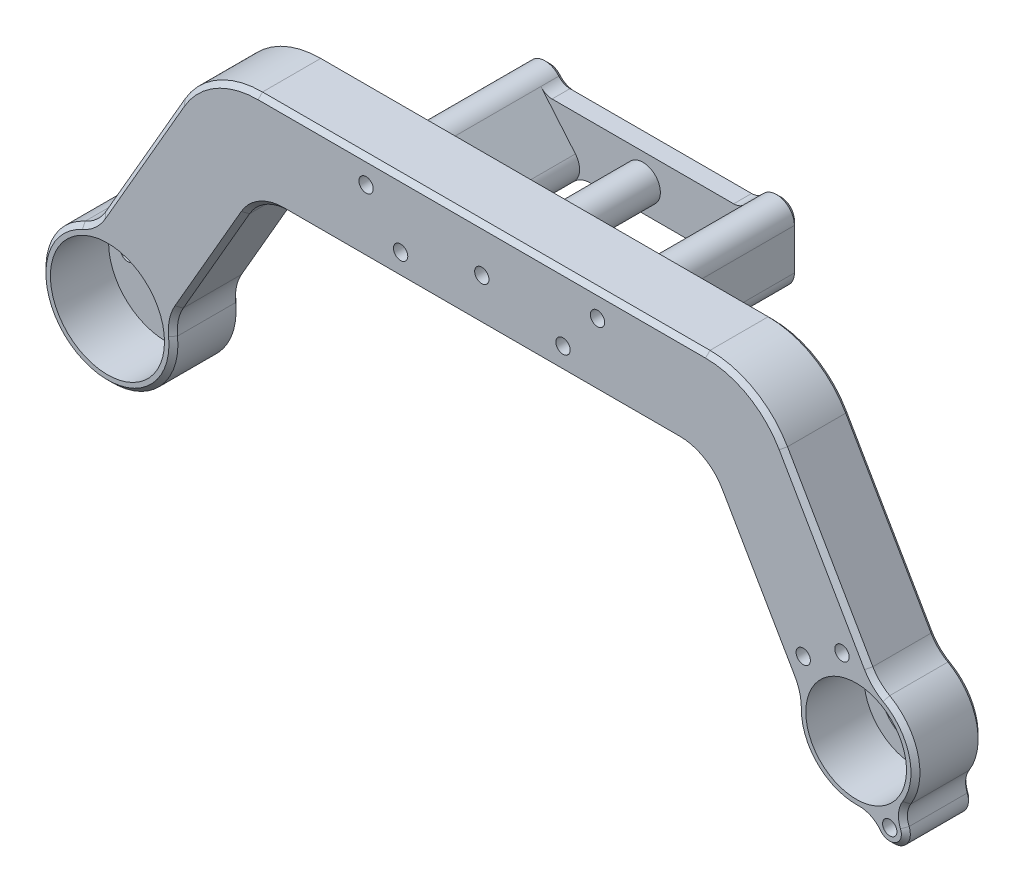
from build123d import *

# Parameters (mm, degrees)
BOSS_EXTRUDE1_DEPTH             = 7.5
CUT_EXTRUDE1_DEPTH              = 111.578168244
CUT_EXTRUDE1_DEPTH_BACK         = 111.578168244
SKETCH3_R                       = 1.6
SKETCH4_R                       = 1.6
BOSS_EXTRUDE2_DEPTH             = 21
BOSS_EXTRUDE2_2_DEPTH           = 21
SKETCH4_R_2                     = 3.9
BOSS_EXTRUDE2_3_DEPTH           = 21
BOSS_EXTRUDE3_START             = 5
SKETCH4_3_R                     = 1.6
SKETCH4_3_R_2                   = 3.9
BOSS_EXTRUDE3_DEPTH             = 5
CHAMFER1_SIZE                   = 1
BOSS_EXTRUDE4_REACH             = 117.298
SKETCH5_R                       = 13.25
SKETCH5_R_2                     = 11.25
BOSS_EXTRUDE4_DIRECTION_2_REACH = 117.298
CUT_EXTRUDE2_DEPTH              = 120.592667834
CUT_EXTRUDE2_DEPTH_BACK         = 120.592667834
SKETCH5_3_R                     = 11.25
BOSS_EXTRUDE5_START             = 5.5
SKETCH5_4_R                     = 11.25
SKETCH5_4_R_2                   = 7.5
BOSS_EXTRUDE5_DEPTH             = 2
CUT_EXTRUDE3_DEPTH              = 120.592667834
CUT_EXTRUDE3_DEPTH_BACK         = 120.592667834
SKETCH5_5_R                     = 12.75
BOSS_EXTRUDE6_START             = -7.5
BOSS_EXTRUDE6_DEPTH             = 15
BOSS_EXTRUDE7_START             = 5.5
SKETCH5_7_R                     = 12.75
SKETCH5_7_R_2                   = 1.6
SKETCH5_7_R_3                   = 5.5
BOSS_EXTRUDE7_DEPTH             = 2
FILLET1_R                       = 10
BOSS_EXTRUDE8_START             = -7.5
BOSS_EXTRUDE8_OUTLINE_R         = 1.6
BOSS_EXTRUDE8_DEPTH             = 15
CUT_EXTRUDE4_DEPTH              = 123.546948151
CUT_EXTRUDE4_DEPTH_BACK         = 123.546948151
SKETCH6_3_R                     = 1.6
CUT_EXTRUDE5_START              = 7.5
SKETCH7_R                       = 3
CUT_EXTRUDE5_DEPTH              = 3.5
CHAMFER2_SIZE                   = 1


# Read off the part's stored shape, not the designer's step: Boss-Extrude6, Boss-Extrude8
with BuildPart() as part:
    # Sketch1 → Boss-Extrude1 (new, symmetric)
    with BuildSketch(Plane.XY):
        with BuildLine():
            Line((-50, 10), (50, 10))
            ThreePointArc((50, 10), (60, 7.320508076), (67.320508076, 0))
            Line((67.320508076, 0), (92.320508076, -43.301270189))
            ThreePointArc((92.320508076, -43.301270189), (88.660254038, -56.961524227), (75, -53.301270189))
            Line((75, -53.301270189), (50, -10))
            Line((50, -10), (-50, -10))
            Line((-50, -10), (-75, -53.301270189))
            ThreePointArc((-75, -53.301270189), (-88.660254038, -56.961524227), (-92.320508076, -43.301270189))
            Line((-92.320508076, -43.301270189), (-67.320508076, 0))
            ThreePointArc((-67.320508076, 0), (-60, 7.320508076), (-50, 10))
        make_face()
    extrude(amount=BOSS_EXTRUDE1_DEPTH, both=True)

    # Sketch3 → Cut-Extrude1 (cut, two sides: drawn at the far end of the back side and taken through both)
    with BuildSketch(Plane.XY.offset(-CUT_EXTRUDE1_DEPTH_BACK)):
        Circle(SKETCH3_R)
        with Locations((25.856725658, 4.596266659)):
            Circle(SKETCH3_R)
        with Locations((18.143274342, -4.596266659)):
            Circle(SKETCH3_R)
        with Locations(Location((-25.856725658, 4.596266659, 0), (0, 0, 180))):
            Circle(SKETCH3_R)
        with Locations(Location((-18.143274342, -4.596266659, 0), (0, 0, 180))):
            Circle(SKETCH3_R)
    extrude(amount=CUT_EXTRUDE1_DEPTH + CUT_EXTRUDE1_DEPTH_BACK, mode=Mode.SUBTRACT)

    # Boss-Extrude4: up to this face of the body (flat: up to its plane)
    boss_extrude4_end = Plane(part.part.faces().sort_by_distance((0, 8.006158576, 7.5))[0])
    # Sketch5 → Boss-Extrude4 (add, up to the picked face)
    with BuildSketch(Plane.XY, mode=Mode.PRIVATE) as boss_extrude4_sk1:
        with Locations((83.660254038, -48.301270189)):
            Circle(SKETCH5_R)
        with Locations((83.660254038, -48.301270189)):
            Circle(SKETCH5_R_2, mode=Mode.SUBTRACT)
    boss_extrude4_tool1 = split(extrude(boss_extrude4_sk1.sketch, amount=BOSS_EXTRUDE4_REACH, mode=Mode.PRIVATE), bisect_by=boss_extrude4_end, keep=Keep.BOTH, mode=Mode.PRIVATE)
    add(boss_extrude4_tool1.solids().sort_by(Axis((70.785021, -48.30127, 0), (0, 0, 1)))[0])

    # Boss-Extrude4 direction 2: up to this face of the body (flat: up to its plane)
    boss_extrude4_direction_2_end = Plane(part.part.faces().sort_by_distance((0, 8.006158576, -7.5))[0])
    # Sketch5 → Boss-Extrude4 direction 2 (add, up to the picked face)
    with BuildSketch(Plane.XY, mode=Mode.PRIVATE) as boss_extrude4_direction_2_sk1:
        with Locations((83.660254038, -48.301270189)):
            Circle(SKETCH5_R)
        with Locations((83.660254038, -48.301270189)):
            Circle(SKETCH5_R_2, mode=Mode.SUBTRACT)
    boss_extrude4_direction_2_tool1 = split(extrude(boss_extrude4_direction_2_sk1.sketch, amount=-BOSS_EXTRUDE4_DIRECTION_2_REACH, mode=Mode.PRIVATE), bisect_by=boss_extrude4_direction_2_end, keep=Keep.BOTH, mode=Mode.PRIVATE)
    add(boss_extrude4_direction_2_tool1.solids().sort_by(Axis((70.785021, -48.30127, 0), (0, 0, -1)))[0])

    # Sketch5<3> → Cut-Extrude2 (cut, two sides: drawn at the far end of the back side and taken through both)
    with BuildSketch(Plane.XY.offset(-CUT_EXTRUDE2_DEPTH_BACK)):
        with Locations(Location((83.660254038, -48.301270189, 0), (0, 0, 180))):
            Circle(SKETCH5_3_R)
    extrude(amount=CUT_EXTRUDE2_DEPTH + CUT_EXTRUDE2_DEPTH_BACK, mode=Mode.SUBTRACT)

    # Sketch5<4> → Boss-Extrude5 (add)
    with BuildSketch(Plane.XY.offset(BOSS_EXTRUDE5_START)):
        with Locations(Location((83.660254038, -48.301270189, 0), (0, 0, 180))):
            Circle(SKETCH5_4_R)
        with Locations(Location((83.660254038, -48.301270189, 0), (0, 0, 180))):
            Circle(SKETCH5_4_R_2, mode=Mode.SUBTRACT)
    extrude(amount=BOSS_EXTRUDE5_DEPTH)

    # Sketch5<5> → Cut-Extrude3 (cut, two sides: drawn at the far end of the back side and taken through both)
    with BuildSketch(Plane.XY.offset(-CUT_EXTRUDE3_DEPTH_BACK)):
        with Locations((-83.660254038, -48.301270189)):
            Circle(SKETCH5_5_R)
    extrude(amount=CUT_EXTRUDE3_DEPTH + CUT_EXTRUDE3_DEPTH_BACK, mode=Mode.SUBTRACT)

    # Boss-Extrude6 outline → Boss-Extrude6 (add)
    with BuildSketch(Plane.XY.offset(BOSS_EXTRUDE6_START)):
        with BuildLine():
            ThreePointArc((-71.045176995, -46.45131581), (-90.035254038, -59.343094087), (-88.365685071, -36.45131581))
            Line((-88.365685071, -36.45131581), (-86.899195965, -33.91128217))
            ThreePointArc((-86.899195965, -33.91128217), (-91.035254037, -61.075144895), (-69.578687889, -43.91128217))
            Line((-69.578687889, -43.91128217), (-71.045176995, -46.45131581))
        make_face()
    extrude(amount=BOSS_EXTRUDE6_DEPTH)

    # Sketch5<7> → Boss-Extrude7 (add)
    with BuildSketch(Plane.XY.offset(BOSS_EXTRUDE7_START)):
        with Locations((-83.660254038, -48.301270189)):
            Circle(SKETCH5_7_R)
        with Locations(Location((-92.160254038, -48.301270189, 0), (0, 0, 180))):
            Circle(SKETCH5_7_R_2, mode=Mode.SUBTRACT)
        with Locations(Location((-83.660254038, -48.301270189, 0), (0, 0, 180))):
            Circle(SKETCH5_7_R_3, mode=Mode.SUBTRACT)
        with Locations(Location((-75.160254038, -48.301270189, 0), (0, 0, 180))):
            Circle(SKETCH5_7_R_2, mode=Mode.SUBTRACT)
    extrude(amount=BOSS_EXTRUDE7_DEPTH)

    # Fillet1
    fillet1_edges = [part.edges().sort_by_distance(p)[0] for p in [
        (-86.899195965, -33.91128217, 0),
        (-69.578687889, -43.91128217, 0),
        (50, -10, 0),
        (-50, -10, 0),
        (70.653665337, -45.773197727, 0),
        (87.974173413, -35.773197727, 0),
    ]]
    fillet(fillet1_edges, radius=FILLET1_R)

    # Boss-Extrude8 outline → Boss-Extrude8 (add)
    with BuildSketch(Plane.XY.offset(BOSS_EXTRUDE8_START)):
        with BuildLine():
            ThreePointArc((94.877990144, -55.352858426), (90.285254038, -59.776106789), (84.158240535, -61.541908748))
            ThreePointArc((84.158240535, -61.541908748), (86.46915215, -62.011467228), (88.307842566, -63.487954685))
            ThreePointArc((88.307842566, -63.487954685), (92.960254038, -64.4093427), (94.488514346, -59.919542169))
            ThreePointArc((94.488514346, -59.919542169), (94.129183909, -57.58894583), (94.877990144, -55.352858426))
        make_face()
        with Locations((91.160254038, -61.291651246)):
            Circle(BOSS_EXTRUDE8_OUTLINE_R, mode=Mode.SUBTRACT)
    extrude(amount=BOSS_EXTRUDE8_DEPTH)

    # Sketch6<3> → Cut-Extrude4 (cut, two sides: drawn at the far end of the back side and taken through both)
    with BuildSketch(Plane.XY.offset(-CUT_EXTRUDE4_DEPTH_BACK)):
        with Locations((71.830127019, -37.810889132)):
            Circle(SKETCH6_3_R)
        with Locations((80.490381057, -32.810889132)):
            Circle(SKETCH6_3_R)
        with Locations(Location((91.160254038, -61.291651246, 0), (0, 0, 180))):
            Circle(SKETCH6_3_R)
    extrude(amount=CUT_EXTRUDE4_DEPTH + CUT_EXTRUDE4_DEPTH_BACK, mode=Mode.SUBTRACT)

    # Sketch7 → Cut-Extrude5 (cut)
    with BuildSketch(Plane.XY.offset(CUT_EXTRUDE5_START)):
        with Locations(Location((80.490381057, -32.810889132, 0), (0, 0, 180))):
            Circle(SKETCH7_R)
        with Locations(Location((71.830127019, -37.810889132, 0), (0, 0, 180))):
            Circle(SKETCH7_R)
        with Locations(Location((91.160254038, -61.291651246, 0), (0, 0, 180))):
            Circle(SKETCH7_R)
    extrude(amount=-CUT_EXTRUDE5_DEPTH, mode=Mode.SUBTRACT)

    # Chamfer2
    # the kernel refuses this chamfer: 1 mm, written as the material it takes off along each edge
    with BuildSketch(Plane(origin=(-85.03074642, -30.675032626, -7.5), x_dir=(-0.023812127644088462, 0.013747938305292346, 0.9996219169112968), z_dir=(0.5000000000000039, 0.8660254037844364, 0))) as chamfer2_piece_1:
        Polygon((CHAMFER2_SIZE * 0.999621916911, CHAMFER2_SIZE * 0.0274958766106), (-CHAMFER2_SIZE * 0.0274958766106, CHAMFER2_SIZE * 0.999621916911), (0, 0), align=None)
    extrude(amount=35.420476688, mode=Mode.SUBTRACT)
    with BuildSketch(Plane(origin=(-50, -10, 7.5), x_dir=(-0.8660254037844343, 0.5000000000000077, 0), z_dir=(-0.5000000000000077, -0.8660254037844343, 0))) as chamfer2_piece_2:
        Polygon((20, CHAMFER2_SIZE), (20 - CHAMFER2_SIZE, 0), (20, 0), align=None)
    revolve(axis=Axis((-50, -10, 7.5), (0, 0, -1)), revolution_arc=60, mode=Mode.SUBTRACT)
    with BuildSketch(Plane(origin=(83.660254038, -48.301270189, 7.5), x_dir=(0.49000237526877505, 0.8717210977319286, 0), z_dir=(-0.8717210977319286, 0.49000237526877505, 0))) as chamfer2_piece_3:
        Polygon((13.25, CHAMFER2_SIZE), (13.25 - CHAMFER2_SIZE, 0), (13.25, 0), align=None)
    revolve(axis=Axis((83.660254038, -48.301270189, 7.5), (0, 0, -1)), revolution_arc=92.813167669, mode=Mode.SUBTRACT)
    with BuildSketch(Plane(origin=(83.660254038, -48.301270189, -7.5), x_dir=(-0.9999338032850952, 0.011506043968479752, 0), z_dir=(0.011506043968479752, 0.9999338032850952, 0))) as chamfer2_piece_4:
        Polygon((13.25, CHAMFER2_SIZE), (13.25 - CHAMFER2_SIZE, 0), (13.25, 0), align=None)
    revolve(axis=Axis((83.660254038, -48.301270189, -7.5), (0, 0, 1)), revolution_arc=92.81316767, mode=Mode.SUBTRACT)
    with BuildSketch(Plane(origin=(-50, -10, -7.5), x_dir=(-0.8660254037844343, 0.5000000000000077, 0), z_dir=(-0.5000000000000077, -0.8660254037844343, 0))) as chamfer2_piece_5:
        Polygon((20, -CHAMFER2_SIZE), (20 - CHAMFER2_SIZE, 0), (20, 0), align=None)
    revolve(axis=Axis((-50, -10, -7.5), (0, 0, -1)), revolution_arc=60, mode=Mode.SUBTRACT)
    with BuildSketch(Plane(origin=(67.320508076, 0, -7.5), x_dir=(0.023812127644087928, 0.013747938305292062, 0.9996219169112968), z_dir=(0.5000000000000047, -0.866025403784436, 0))) as chamfer2_piece_6:
        Polygon((CHAMFER2_SIZE * 0.999621916911, CHAMFER2_SIZE * 0.0274958766106), (-CHAMFER2_SIZE * 0.0274958766106, CHAMFER2_SIZE * 0.999621916911), (0, 0), align=None)
    extrude(amount=38.144094299, mode=Mode.SUBTRACT)
    with BuildSketch(Plane(origin=(67.320508076, 0, 7.5), x_dir=(0.02381212764408793, 0.013747938305292064, -0.9996219169112968), z_dir=(0.5000000000000047, -0.866025403784436, 0))) as chamfer2_piece_7:
        Polygon((CHAMFER2_SIZE * 0.999621916911, -CHAMFER2_SIZE * 0.0274958766106), (-CHAMFER2_SIZE * 0.0274958766106, -CHAMFER2_SIZE * 0.999621916911), (0, 0), align=None)
    extrude(amount=38.144094299, mode=Mode.SUBTRACT)
    with BuildSketch(Plane(origin=(69.072047149, -43.033754667, 7.5), x_dir=(-0.02381212764408995, -0.013747938305293224, -0.9996219169112968), z_dir=(-0.5000000000000044, 0.8660254037844362, 0))) as chamfer2_piece_8:
        Polygon((CHAMFER2_SIZE * 0.999621916911, -CHAMFER2_SIZE * 0.0274958766106), (-CHAMFER2_SIZE * 0.0274958766106, -CHAMFER2_SIZE * 0.999621916911), (0, 0), align=None)
    extrude(amount=32.370591607, mode=Mode.SUBTRACT)
    with BuildSketch(Plane(origin=(69.072047149, -43.033754667, -7.5), x_dir=(-0.023812127644092938, -0.013747938305294949, 0.9996219169112965), z_dir=(-0.5000000000000044, 0.8660254037844362, 0))) as chamfer2_piece_9:
        Polygon((CHAMFER2_SIZE * 0.999621916911, CHAMFER2_SIZE * 0.0274958766106), (-CHAMFER2_SIZE * 0.0274958766106, CHAMFER2_SIZE * 0.999621916911), (0, 0), align=None)
    extrude(amount=32.370591607, mode=Mode.SUBTRACT)
    with BuildSketch(Plane(origin=(-50, 10, -7.5), x_dir=(0, 0.027495876610585623, 0.9996219169112968), z_dir=(1, 0, 0))) as chamfer2_piece_10:
        Polygon((CHAMFER2_SIZE * 0.999621916911, CHAMFER2_SIZE * 0.0274958766106), (-CHAMFER2_SIZE * 0.0274958766106, CHAMFER2_SIZE * 0.999621916911), (0, 0), align=None)
    extrude(amount=100, mode=Mode.SUBTRACT)
    with BuildSketch(Plane(origin=(-83.660254037, -48.301270189, 7.5), x_dir=(-0.40528268364964415, 0.9141914166812891, 0), z_dir=(0.9141914166812891, 0.40528268364964415, 0))) as chamfer2_piece_11:
        Polygon((14.75, -CHAMFER2_SIZE), (14.75 - CHAMFER2_SIZE, 0), (14.75, 0), align=None)
    revolve(axis=Axis((-83.660254037, -48.301270189, 7.5), (0, 0, 1)), revolution_arc=252.182314475, mode=Mode.SUBTRACT)
    with BuildSketch(Plane(origin=(-83.660254037, -48.301270189, -7.5), x_dir=(-0.40528268364964415, 0.9141914166812891, 0), z_dir=(0.9141914166812891, 0.40528268364964415, 0))) as chamfer2_piece_12:
        Polygon((14.75, CHAMFER2_SIZE), (14.75 - CHAMFER2_SIZE, 0), (14.75, 0), align=None)
    revolve(axis=Axis((-83.660254037, -48.301270189, -7.5), (0, 0, 1)), revolution_arc=252.182314475, mode=Mode.SUBTRACT)
    with BuildSketch(Plane(origin=(50, -10, -7.5), x_dir=(0, 1, 0), z_dir=(-1, 0, 0))) as chamfer2_piece_13:
        Polygon((20, -CHAMFER2_SIZE), (20 - CHAMFER2_SIZE, 0), (20, 0), align=None)
    revolve(axis=Axis((50, -10, -7.5), (0, 0, -1)), revolution_arc=60, mode=Mode.SUBTRACT)
    with BuildSketch(Plane(origin=(-52.886751346, -15, -7.5), x_dir=(0.023812127644087716, -0.01374793830529191, 0.9996219169112968), z_dir=(-0.5000000000000038, -0.8660254037844366, 0))) as chamfer2_piece_14:
        Polygon((CHAMFER2_SIZE * 0.999621916911, CHAMFER2_SIZE * 0.0274958766106), (-CHAMFER2_SIZE * 0.0274958766106, CHAMFER2_SIZE * 0.999621916911), (0, 0), align=None)
    extrude(amount=29.646973996, mode=Mode.SUBTRACT)
    with BuildSketch(Plane(origin=(-52.886751346, -15, 7.5), x_dir=(0.02381212764408697, -0.013747938305291477, -0.9996219169112968), z_dir=(-0.5000000000000038, -0.8660254037844366, 0))) as chamfer2_piece_15:
        Polygon((CHAMFER2_SIZE * 0.999621916911, -CHAMFER2_SIZE * 0.0274958766106), (-CHAMFER2_SIZE * 0.0274958766106, -CHAMFER2_SIZE * 0.999621916911), (0, 0), align=None)
    extrude(amount=29.646973996, mode=Mode.SUBTRACT)
    with BuildSketch(Plane(origin=(44.226497308, -10, -7.5), x_dir=(0, -0.027495876610585623, 0.9996219169112968), z_dir=(-1, 0, 0))) as chamfer2_piece_16:
        Polygon((CHAMFER2_SIZE * 0.999621916911, CHAMFER2_SIZE * 0.0274958766106), (-CHAMFER2_SIZE * 0.0274958766106, CHAMFER2_SIZE * 0.999621916911), (0, 0), align=None)
    extrude(amount=88.452994616, mode=Mode.SUBTRACT)
    with BuildSketch(Plane(origin=(44.226497308, -10, 7.5), x_dir=(0, -0.027495876610585623, -0.9996219169112968), z_dir=(-1, 0, 0))) as chamfer2_piece_17:
        Polygon((CHAMFER2_SIZE * 0.999621916911, -CHAMFER2_SIZE * 0.0274958766106), (-CHAMFER2_SIZE * 0.0274958766106, -CHAMFER2_SIZE * 0.999621916911), (0, 0), align=None)
    extrude(amount=88.452994616, mode=Mode.SUBTRACT)
    with BuildSketch(Plane(origin=(95.052809263, -28.033754667, 7.5), x_dir=(-0.49000237526877577, -0.8717210977319282, 0), z_dir=(0.8717210977319282, -0.49000237526877577, 0))) as chamfer2_piece_18:
        Polygon((10, CHAMFER2_SIZE), (10 + CHAMFER2_SIZE, 0), (10, 0), align=None)
    revolve(axis=Axis((95.052809263, -28.033754667, 7.5), (0, 0, -1)), revolution_arc=30.659262305, mode=Mode.SUBTRACT)
    with BuildSketch(Plane(origin=(95.052809263, -28.033754667, -7.5), x_dir=(-0.49000237526877577, -0.8717210977319282, 0), z_dir=(0.8717210977319282, -0.49000237526877577, 0))) as chamfer2_piece_19:
        Polygon((10, -CHAMFER2_SIZE), (10 + CHAMFER2_SIZE, 0), (10, 0), align=None)
    revolve(axis=Axis((95.052809263, -28.033754667, -7.5), (0, 0, -1)), revolution_arc=30.659262305, mode=Mode.SUBTRACT)
    with BuildSketch(Plane(origin=(60.411793111, -48.033754667, -7.5), x_dir=(0.9999338032850952, -0.011506043968478964, 0), z_dir=(-0.011506043968478964, -0.9999338032850952, 0))) as chamfer2_piece_20:
        Polygon((10, CHAMFER2_SIZE), (10 + CHAMFER2_SIZE, 0), (10, 0), align=None)
    revolve(axis=Axis((60.411793111, -48.033754667, -7.5), (0, 0, 1)), revolution_arc=30.659262305, mode=Mode.SUBTRACT)
    with BuildSketch(Plane(origin=(60.411793111, -48.033754667, 7.5), x_dir=(0.9999338032850952, -0.011506043968478964, 0), z_dir=(-0.011506043968478964, -0.9999338032850952, 0))) as chamfer2_piece_21:
        Polygon((10, -CHAMFER2_SIZE), (10 + CHAMFER2_SIZE, 0), (10, 0), align=None)
    revolve(axis=Axis((60.411793111, -48.033754667, 7.5), (0, 0, 1)), revolution_arc=30.659262305, mode=Mode.SUBTRACT)
    with BuildSketch(Plane(origin=(-93.691000458, -25.675032626, -7.5), x_dir=(0.40528268364964504, -0.9141914166812889, 0), z_dir=(-0.9141914166812889, -0.40528268364964504, 0))) as chamfer2_piece_22:
        Polygon((10, CHAMFER2_SIZE), (10 + CHAMFER2_SIZE, 0), (10, 0), align=None)
    revolve(axis=Axis((-93.691000458, -25.675032626, -7.5), (0, 0, 1)), revolution_arc=36.091157236, mode=Mode.SUBTRACT)
    with BuildSketch(Plane(origin=(-93.691000458, -25.675032626, 7.5), x_dir=(0.40528268364964504, -0.9141914166812889, 0), z_dir=(-0.9141914166812889, -0.40528268364964504, 0))) as chamfer2_piece_23:
        Polygon((10, -CHAMFER2_SIZE), (10 + CHAMFER2_SIZE, 0), (10, 0), align=None)
    revolve(axis=Axis((-93.691000458, -25.675032626, 7.5), (0, 0, 1)), revolution_arc=36.091157236, mode=Mode.SUBTRACT)
    with BuildSketch(Plane(origin=(-59.049984306, -45.675032625, 7.5), x_dir=(-0.8660254037844359, 0.5000000000000047, 0), z_dir=(0.5000000000000047, 0.8660254037844359, 0))) as chamfer2_piece_24:
        Polygon((10, -CHAMFER2_SIZE), (10 + CHAMFER2_SIZE, 0), (10, 0), align=None)
    revolve(axis=Axis((-59.049984306, -45.675032625, 7.5), (0, 0, 1)), revolution_arc=36.091157239, mode=Mode.SUBTRACT)
    with BuildSketch(Plane(origin=(-59.049984306, -45.675032625, -7.5), x_dir=(-0.8660254037844369, 0.5000000000000029, 0), z_dir=(0.5000000000000029, 0.8660254037844369, 0))) as chamfer2_piece_25:
        Polygon((10, CHAMFER2_SIZE), (10 + CHAMFER2_SIZE, 0), (10, 0), align=None)
    revolve(axis=Axis((-59.049984306, -45.675032625, -7.5), (0, 0, 1)), revolution_arc=36.091157239, mode=Mode.SUBTRACT)
    with BuildSketch(Plane(origin=(44.226497308, -20, -7.5), x_dir=(0.8660254037844365, 0.5000000000000038, 0), z_dir=(0.5000000000000038, -0.8660254037844365, 0))) as chamfer2_piece_26:
        Polygon((10, CHAMFER2_SIZE), (10 + CHAMFER2_SIZE, 0), (10, 0), align=None)
    revolve(axis=Axis((44.226497308, -20, -7.5), (0, 0, 1)), revolution_arc=60, mode=Mode.SUBTRACT)
    with BuildSketch(Plane(origin=(44.226497308, -20, 7.5), x_dir=(0.8660254037844359, 0.5000000000000046, 0), z_dir=(0.5000000000000046, -0.8660254037844359, 0))) as chamfer2_piece_27:
        Polygon((10, -CHAMFER2_SIZE), (10 + CHAMFER2_SIZE, 0), (10, 0), align=None)
    revolve(axis=Axis((44.226497308, -20, 7.5), (0, 0, 1)), revolution_arc=60, mode=Mode.SUBTRACT)
    with BuildSketch(Plane(origin=(-44.226497308, -20, -7.5), x_dir=(0, 1, 0), z_dir=(1, 0, 0))) as chamfer2_piece_28:
        Polygon((10, CHAMFER2_SIZE), (10 + CHAMFER2_SIZE, 0), (10, 0), align=None)
    revolve(axis=Axis((-44.226497308, -20, -7.5), (0, 0, 1)), revolution_arc=60, mode=Mode.SUBTRACT)
    with BuildSketch(Plane(origin=(-44.226497308, -20, 7.5), x_dir=(0, 1, 0), z_dir=(1, 0, 0))) as chamfer2_piece_29:
        Polygon((10, -CHAMFER2_SIZE), (10 + CHAMFER2_SIZE, 0), (10, 0), align=None)
    revolve(axis=Axis((-44.226497308, -20, 7.5), (0, 0, 1)), revolution_arc=60, mode=Mode.SUBTRACT)
    with BuildSketch(Plane(origin=(-85.03074642, -30.675032626, 7.5), x_dir=(-0.023812127644088462, 0.013747938305292346, -0.9996219169112968), z_dir=(0.5000000000000039, 0.8660254037844364, 0))) as chamfer2_piece_30:
        Polygon((CHAMFER2_SIZE * 0.999621916911, -CHAMFER2_SIZE * 0.0274958766106), (-CHAMFER2_SIZE * 0.0274958766106, -CHAMFER2_SIZE * 0.999621916911), (0, 0), align=None)
    extrude(amount=35.420476688, mode=Mode.SUBTRACT)
    with BuildSketch(Plane(origin=(83.660254038, -48.301270189, -7.5), x_dir=(0.8466215928971065, -0.5321953386120232, 0), z_dir=(-0.5321953386120232, -0.8466215928971065, 0))) as chamfer2_piece_31:
        Polygon((13.25, CHAMFER2_SIZE), (13.25 - CHAMFER2_SIZE, 0), (13.25, 0), align=None)
    revolve(axis=Axis((83.660254038, -48.301270189, -7.5), (0, 0, 1)), revolution_arc=92.813167669, mode=Mode.SUBTRACT)
    with BuildSketch(Plane(origin=(83.660254038, -48.301270189, 7.5), x_dir=(0.03758388657824293, -0.9992934761468593, 0), z_dir=(0.9992934761468593, 0.03758388657824293, 0))) as chamfer2_piece_32:
        Polygon((13.25, CHAMFER2_SIZE), (13.25 - CHAMFER2_SIZE, 0), (13.25, 0), align=None)
    revolve(axis=Axis((83.660254038, -48.301270189, 7.5), (0, 0, -1)), revolution_arc=92.81316767, mode=Mode.SUBTRACT)
    with BuildSketch(Plane(origin=(91.160254038, -61.291651247, 7.5), x_dir=(-0.7923365200184813, -0.6100842884757833, 0), z_dir=(-0.6100842884757833, 0.7923365200184813, 0))) as chamfer2_piece_33:
        Polygon((3.6, -CHAMFER2_SIZE), (3.6 - CHAMFER2_SIZE, 0), (3.6, 0), align=None)
    revolve(axis=Axis((91.160254038, -61.291651247, 7.5), (0, 0, 1)), revolution_arc=164.808804361, mode=Mode.SUBTRACT)
    with BuildSketch(Plane(origin=(91.160254038, -61.291651247, -7.5), x_dir=(-0.7923365200184813, -0.6100842884757833, 0), z_dir=(-0.6100842884757833, 0.7923365200184813, 0))) as chamfer2_piece_34:
        Polygon((3.6, CHAMFER2_SIZE), (3.6 - CHAMFER2_SIZE, 0), (3.6, 0), align=None)
    revolve(axis=Axis((91.160254038, -61.291651247, -7.5), (0, 0, 1)), revolution_arc=164.808804361, mode=Mode.SUBTRACT)
    with BuildSketch(Plane(origin=(99.11109811, -58.013835119, 7.5), x_dir=(-0.9245167525351079, -0.381141409823097, 0), z_dir=(0.381141409823097, -0.9245167525351079, 0))) as chamfer2_piece_35:
        Polygon((5.000000001, CHAMFER2_SIZE), (5.000000001 + CHAMFER2_SIZE, 0), (5.000000001, 0), align=None)
    revolve(axis=Axis((99.11109811, -58.013835119, 7.5), (0, 0, -1)), revolution_arc=54.558307499, mode=Mode.SUBTRACT)
    with BuildSketch(Plane(origin=(99.11109811, -58.013835119, -7.5), x_dir=(-0.9245167525351079, -0.381141409823097, 0), z_dir=(0.381141409823097, -0.9245167525351079, 0))) as chamfer2_piece_36:
        Polygon((5.000000001 + CHAMFER2_SIZE, 0), (5.000000001, -CHAMFER2_SIZE), (5.000000001, 0), align=None)
    revolve(axis=Axis((99.11109811, -58.013835119, -7.5), (0, 0, -1)), revolution_arc=54.558307499, mode=Mode.SUBTRACT)
    with BuildSketch(Plane(origin=(84.346159969, -66.538376125, 7.5), x_dir=(-0.03758388681001505, 0.9992934761381423, 0), z_dir=(-0.9992934761381423, -0.03758388681001505, 0))) as chamfer2_piece_37:
        Polygon((4.999999996, CHAMFER2_SIZE), (4.999999996 + CHAMFER2_SIZE, 0), (4.999999996, 0), align=None)
    revolve(axis=Axis((84.346159969, -66.538376125, 7.5), (0, 0, -1)), revolution_arc=54.558307562, mode=Mode.SUBTRACT)
    with BuildSketch(Plane(origin=(84.346159969, -66.538376125, -7.5), x_dir=(-0.03758388681001505, 0.9992934761381423, 0), z_dir=(-0.9992934761381423, -0.03758388681001505, 0))) as chamfer2_piece_38:
        Polygon((4.999999996, -CHAMFER2_SIZE), (4.999999996 + CHAMFER2_SIZE, 0), (4.999999996, 0), align=None)
    revolve(axis=Axis((84.346159969, -66.538376125, -7.5), (0, 0, -1)), revolution_arc=54.558307562, mode=Mode.SUBTRACT)
    with BuildSketch(Plane(origin=(50, -10, 7.5), x_dir=(0, 1, 0), z_dir=(-1, 0, 0))) as chamfer2_piece_39:
        Polygon((20, CHAMFER2_SIZE), (20 - CHAMFER2_SIZE, 0), (20, 0), align=None)
    revolve(axis=Axis((50, -10, 7.5), (0, 0, -1)), revolution_arc=60, mode=Mode.SUBTRACT)
    with BuildSketch(Plane(origin=(-50, 10, 7.5), x_dir=(0, 0.027495876610585623, -0.9996219169112968), z_dir=(1, 0, 0))) as chamfer2_piece_40:
        Polygon((CHAMFER2_SIZE * 0.999621916911, -CHAMFER2_SIZE * 0.0274958766106), (-CHAMFER2_SIZE * 0.0274958766106, -CHAMFER2_SIZE * 0.999621916911), (0, 0), align=None)
    extrude(amount=100, mode=Mode.SUBTRACT)


with BuildPart() as body_2:
    # Sketch4 → Boss-Extrude2 (new body)
    with BuildSketch(Plane.XY.offset(28.5)):
        with BuildLine():
            Line((-25.856725658, -8.596266659), (-18.143274342, -8.596266659))
            ThreePointArc((-18.143274342, -8.596266659), (-14.518043194, -6.286739706), (-15.079096569, -2.02511622))
            Line((-15.079096569, -2.02511622), (-22.792547886, 7.167417097))
            ThreePointArc((-22.792547886, 7.167417097), (-27.224806231, 8.355037142), (-29.856725658, 4.596266659))
            Line((-29.856725658, 4.596266659), (-29.856725658, -4.596266659))
            ThreePointArc((-29.856725658, -4.596266659), (-28.685152783, -7.424693783), (-25.856725658, -8.596266659))
        make_face()
        with Locations(Location((-18.143274342, -4.596266659, 0), (0, 0, 180))):
            Circle(SKETCH4_R, mode=Mode.SUBTRACT)
        with Locations(Location((-25.856725658, 4.596266659, 0), (0, 0, 180))):
            Circle(SKETCH4_R, mode=Mode.SUBTRACT)
    extrude(amount=-BOSS_EXTRUDE2_DEPTH)



with BuildPart() as body_3:
    # Sketch4 → Boss-Extrude2 2 (new body)
    with BuildSketch(Plane.XY.offset(28.5)):
        with BuildLine():
            ThreePointArc((18.143274342, -8.596266659), (14.518043194, -6.286739706), (15.079096569, -2.02511622))
            Line((15.079096569, -2.02511622), (22.792547886, 7.167417097))
            ThreePointArc((22.792547886, 7.167417097), (27.224806231, 8.355037142), (29.856725658, 4.596266659))
            Line((29.856725658, 4.596266659), (29.856725658, -4.596266659))
            ThreePointArc((29.856725658, -4.596266659), (28.685152783, -7.424693783), (25.856725658, -8.596266659))
            Line((25.856725658, -8.596266659), (18.143274342, -8.596266659))
        make_face()
        with Locations((18.143274342, -4.596266659)):
            Circle(SKETCH4_R, mode=Mode.SUBTRACT)
        with Locations((25.856725658, 4.596266659)):
            Circle(SKETCH4_R, mode=Mode.SUBTRACT)
    extrude(amount=-BOSS_EXTRUDE2_2_DEPTH)


with BuildPart() as body_4:
    # Sketch4 → Boss-Extrude2 3 (new body)
    with BuildSketch(Plane.XY.offset(28.5)):
        Circle(SKETCH4_R_2)
        Circle(SKETCH4_R, mode=Mode.SUBTRACT)
    extrude(amount=-BOSS_EXTRUDE2_3_DEPTH)


with BuildPart() as body_2_1:
    add(body_2.part)

    add(body_3.part)  # Boss-Extrude3 merges body 3

    add(body_4.part)  # Boss-Extrude3 merges body 4
    # Sketch4<3> → Boss-Extrude3 (add)
    # profile 1 of 5: a face of its own
    with BuildSketch(Plane.XY.offset(28.5).offset(BOSS_EXTRUDE3_START)):
        with BuildLine():
            Line((-25.856725658, -8.596266659), (-18.143274342, -8.596266659))
            ThreePointArc((-18.143274342, -8.596266659), (-14.518043194, -6.286739706), (-15.079096569, -2.02511622))
            Line((-15.079096569, -2.02511622), (-22.792547886, 7.167417097))
            ThreePointArc((-22.792547886, 7.167417097), (-27.224806231, 8.355037142), (-29.856725658, 4.596266659))
            Line((-29.856725658, 4.596266659), (-29.856725658, -4.596266659))
            ThreePointArc((-29.856725658, -4.596266659), (-28.685152783, -7.424693783), (-25.856725658, -8.596266659))
        make_face()
        with Locations(Location((-18.143274342, -4.596266659, 0), (0, 0, 180))):
            Circle(SKETCH4_3_R, mode=Mode.SUBTRACT)
        with Locations(Location((-25.856725658, 4.596266659, 0), (0, 0, 180))):
            Circle(SKETCH4_3_R, mode=Mode.SUBTRACT)
    # profile 2 of 5: a face of its own
    with BuildSketch(Plane.XY.offset(28.5).offset(BOSS_EXTRUDE3_START)):
        with BuildLine():
            Line((0, 3.9), (0, 6))
            Line((0, 6), (-20.289013841, 6))
            ThreePointArc((-20.289013841, 6), (-21.670185933, 6.306198481), (-22.792547886, 7.167417097))
            Line((-22.792547886, 7.167417097), (-15.079096569, -2.02511622))
            ThreePointArc((-15.079096569, -2.02511622), (-14.147648015, -4.783270014), (-15.332634968, -7.442370366))
            ThreePointArc((-15.332634968, -7.442370366), (-13.718263321, -6.374627141), (-11.819335752, -6))
            Line((-11.819335752, -6), (0, -6))
            Line((0, -6), (0, -3.9))
            ThreePointArc((0, -3.9), (-3.9, 0), (0, 3.9))
        make_face()
    # profile 3 of 5: a face of its own
    with BuildSketch(Plane.XY.offset(28.5).offset(BOSS_EXTRUDE3_START)):
        Circle(SKETCH4_3_R_2)
        Circle(SKETCH4_3_R, mode=Mode.SUBTRACT)
    # profile 4 of 5: a face of its own
    with BuildSketch(Plane.XY.offset(28.5).offset(BOSS_EXTRUDE3_START)):
        with BuildLine():
            ThreePointArc((15.332634968, -7.442370366), (14.147648015, -4.783270014), (15.079096569, -2.02511622))
            Line((15.079096569, -2.02511622), (22.792547886, 7.167417097))
            ThreePointArc((22.792547886, 7.167417097), (21.670185933, 6.306198481), (20.289013841, 6))
            Line((20.289013841, 6), (0, 6))
            Line((0, 6), (0, 3.9))
            ThreePointArc((0, 3.9), (2.757716447, 2.757716447), (3.9, 0))
            ThreePointArc((3.9, 0), (2.757716447, -2.757716447), (0, -3.9))
            Line((0, -3.9), (0, -6))
            Line((0, -6), (11.819335752, -6))
            ThreePointArc((11.819335752, -6), (13.718263321, -6.374627141), (15.332634968, -7.442370366))
        make_face()
    # profile 5 of 5: a face of its own
    with BuildSketch(Plane.XY.offset(28.5).offset(BOSS_EXTRUDE3_START)):
        with BuildLine():
            ThreePointArc((18.143274342, -8.596266659), (14.518043194, -6.286739706), (15.079096569, -2.02511622))
            Line((15.079096569, -2.02511622), (22.792547886, 7.167417097))
            ThreePointArc((22.792547886, 7.167417097), (27.224806231, 8.355037142), (29.856725658, 4.596266659))
            Line((29.856725658, 4.596266659), (29.856725658, -4.596266659))
            ThreePointArc((29.856725658, -4.596266659), (28.685152783, -7.424693783), (25.856725658, -8.596266659))
            Line((25.856725658, -8.596266659), (18.143274342, -8.596266659))
        make_face()
        with Locations((18.143274342, -4.596266659)):
            Circle(SKETCH4_3_R, mode=Mode.SUBTRACT)
        with Locations((25.856725658, 4.596266659)):
            Circle(SKETCH4_3_R, mode=Mode.SUBTRACT)
    extrude(amount=-BOSS_EXTRUDE3_DEPTH)

    # Chamfer1
    chamfer1_edges = [body_2_1.edges().sort_by_distance(p)[0] for p in [
        (16.624132286, -8.296564946, 33.5),
        (22, -8.596266659, 33.5),
        (28.685152783, -7.424693783, 33.5),
        (29.856725658, 0, 33.5),
        (27.224806231, 8.355037142, 33.5),
        (-21.670185933, 6.306198481, 33.5),
        (-13.718263321, -6.374627141, 33.5),
        (0, -6, 33.5),
        (13.718263321, -6.374627141, 33.5),
        (21.670185933, 6.306198481, 33.5),
        (0, 6, 33.5),
        (-27.224806231, 8.355037142, 33.5),
        (-29.856725658, 0, 33.5),
        (-28.685152783, -7.424693783, 33.5),
        (-22, -8.596266659, 33.5),
        (-16.624132286, -8.296564946, 33.5),
    ]]
    chamfer(chamfer1_edges, length=CHAMFER1_SIZE)


with BuildPart() as body_3_2:
    # Mirror1: mirrored copy
    add(part.part.mirror(Plane.XY))


with BuildPart() as body_4_2:
    # Mirror1 2: mirrored copy
    add(body_2_1.part.mirror(Plane.XY))


solid = Compound([body_3_2.part, body_4_2.part])
